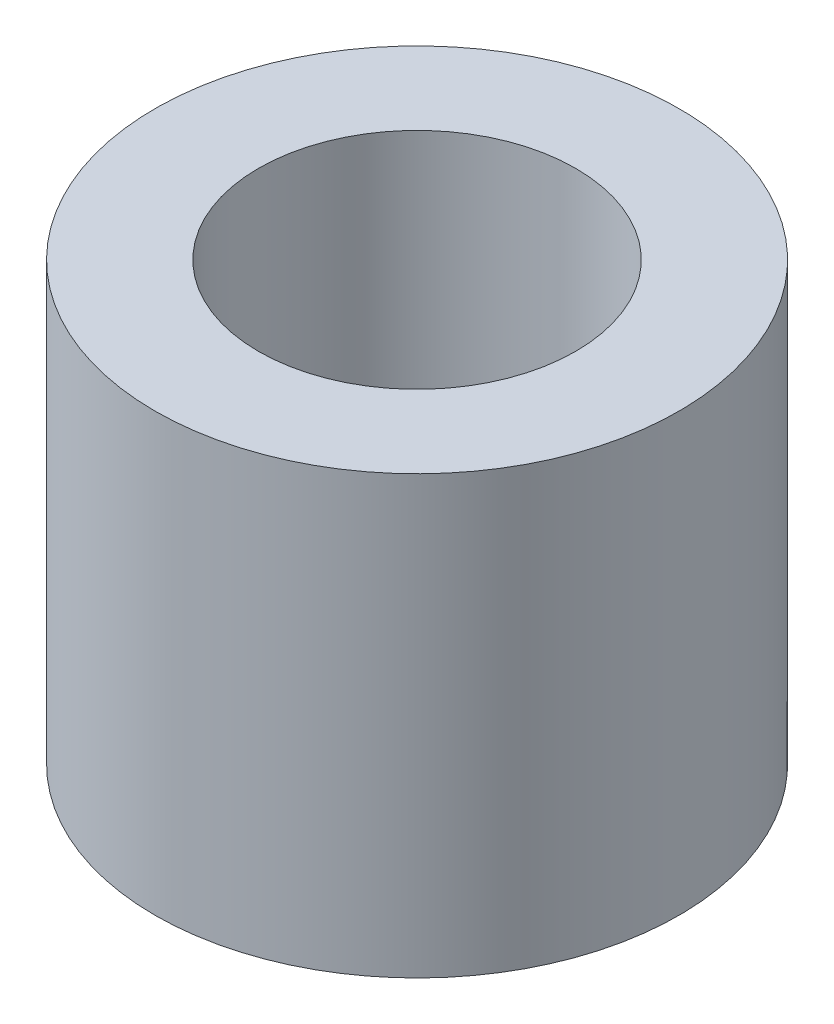
from build123d import *

# Parameters (mm, degrees)
SKETCH1_R               = 15
SKETCH1_R_2             = 2.5
BOSS_EXTRUDE1_DEPTH     = 25
G1_4_TAPPED_HOLE1_D     = 11.8
G1_4_TAPPED_HOLE1_DEPTH = 15
G1_4_TAPPED_HOLE1_TIP   = 3.545077652
G1_4_TAPPED_HOLE2_D     = 11.8
G1_4_TAPPED_HOLE2_DEPTH = 10
G1_4_TAPPED_HOLE2_TIP   = 3.545077652
SKETCH11_R              = 9.0785
CUT_EXTRUDE3_DEPTH      = 15


with BuildPart() as part:
    # Sketch1 → Boss-Extrude1 (new body)
    with BuildSketch(Plane(origin=(0, 0, 0), x_dir=(1, 0, 0), z_dir=(0, 1, 0))):
        Circle(SKETCH1_R)
        Circle(SKETCH1_R_2, mode=Mode.SUBTRACT)
    extrude(amount=BOSS_EXTRUDE1_DEPTH)

    # G1/4 Tapped Hole1
    with Locations(Plane(origin=(0, 25, 0), x_dir=(1, 0, 0), z_dir=(0, 1, 0))):
        with Locations((0, 0)):
            Hole(G1_4_TAPPED_HOLE1_D / 2, depth=G1_4_TAPPED_HOLE1_DEPTH)
            with Locations((0, 0, -(G1_4_TAPPED_HOLE1_DEPTH + G1_4_TAPPED_HOLE1_TIP / 2))):  # 118° drill point
                Cone(0, G1_4_TAPPED_HOLE1_D / 2, G1_4_TAPPED_HOLE1_TIP, mode=Mode.SUBTRACT)

    # G1/4 Tapped Hole2
    with Locations(Plane(origin=(0, 0, 0), x_dir=(-1, 0, 0), z_dir=(0, -1, 0))):
        with Locations((0, 0)):
            Hole(G1_4_TAPPED_HOLE2_D / 2, depth=G1_4_TAPPED_HOLE2_DEPTH)
            with Locations((0, 0, -(G1_4_TAPPED_HOLE2_DEPTH + G1_4_TAPPED_HOLE2_TIP / 2))):  # 118° drill point
                Cone(0, G1_4_TAPPED_HOLE2_D / 2, G1_4_TAPPED_HOLE2_TIP, mode=Mode.SUBTRACT)

    # Sketch11 → Cut-Extrude3 (cut)
    with BuildSketch(Plane(origin=(0, 25, 0), x_dir=(1, 0, 0), z_dir=(0, 1, 0))):
        Circle(SKETCH11_R)
    extrude(amount=-CUT_EXTRUDE3_DEPTH, mode=Mode.SUBTRACT)


solid = part.part
